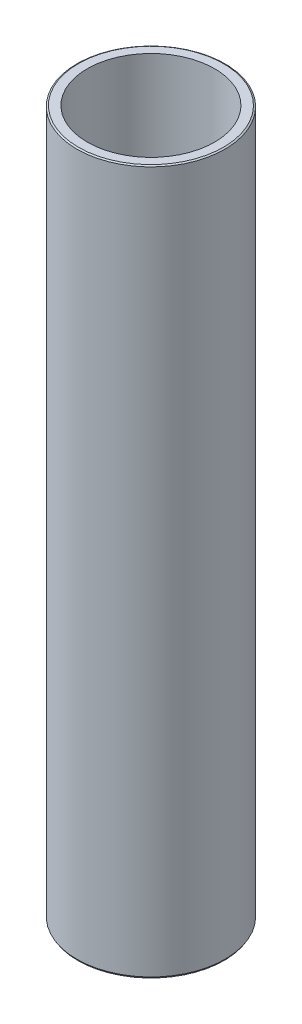
from build123d import *
from OCP.BRepFilletAPI import BRepFilletAPI_MakeChamfer

# Parameters (mm, degrees)
SKETCH1_R           = 60
BOSS_EXTRUDE1_DEPTH = 570.494041373
SKETCH2_R           = 51.593794562
CUT_EXTRUDE1_DEPTH  = 577.769842522
CHAMFER1_SIZE       = 0.717866947
CHAMFER1_SIZE2      = 1.243382025


with BuildPart() as part:
    # Sketch1 → Boss-Extrude1 (new body)
    with BuildSketch(Plane(origin=(0, 0, 0), x_dir=(1, 0, 0), z_dir=(0, 1, 0))):
        Circle(SKETCH1_R)
    extrude(amount=BOSS_EXTRUDE1_DEPTH)

    # Sketch2 → Cut-Extrude1 (cut, through all)
    with BuildSketch(Plane(origin=(0, 0, 0), x_dir=(1, 0, 0), z_dir=(0, 1, 0))):
        Circle(SKETCH2_R)
    extrude(amount=CUT_EXTRUDE1_DEPTH, mode=Mode.SUBTRACT)

    # Chamfer1: one chamfer whose edges measure the first distance from different faces: ONE call of the kernel's chamfer builder (chamfer() names one face for all edges)
    chamfer1_edges_1 = [part.edges().sort_by_distance(p)[0] for p in [
        (-60, 570.494041373, 0),
    ]]
    chamfer1_side_1 = [part.faces().sort_by_distance(p)[0] for p in [
        (-60, 285.247020687, 0),
    ]]
    chamfer1_edges_2 = [part.edges().sort_by_distance(p)[0] for p in [
        (-60, 0, 0),
    ]]
    chamfer1_side_2 = [part.faces().sort_by_distance(p)[0] for p in [
        (-58.302943725, 0, 0),
    ]]
    chamfer1 = BRepFilletAPI_MakeChamfer(part.part.solid().wrapped)
    for e in chamfer1_edges_1:
        chamfer1.Add(CHAMFER1_SIZE, CHAMFER1_SIZE2, e.wrapped, chamfer1_side_1[0].wrapped)  # the first distance lies on this face
    for e in chamfer1_edges_2:
        chamfer1.Add(CHAMFER1_SIZE, CHAMFER1_SIZE2, e.wrapped, chamfer1_side_2[0].wrapped)  # the first distance lies on this face
    add(Compound.cast(chamfer1.Shape()), mode=Mode.REPLACE)


solid = part.part
